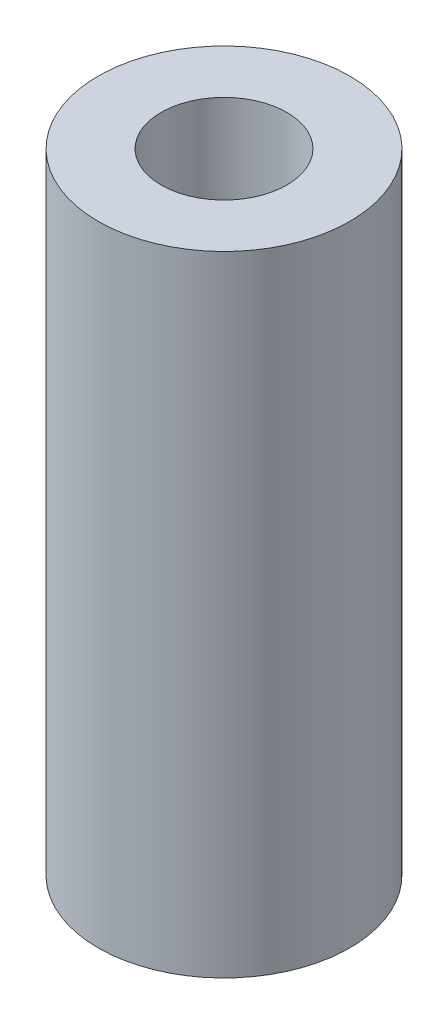
from build123d import *

# Parameters (mm, degrees)
SKETCH1_R           = 1
SKETCH1_R_2         = 0.5
BOSS_EXTRUDE1_DEPTH = 5


with BuildPart() as part:
    # Sketch1 → Boss-Extrude1 (new body)
    with BuildSketch(Plane(origin=(0, 0, 0), x_dir=(1, 0, 0), z_dir=(0, 1, 0))):
        Circle(SKETCH1_R)
        Circle(SKETCH1_R_2, mode=Mode.SUBTRACT)
    extrude(amount=BOSS_EXTRUDE1_DEPTH)


solid = part.part
